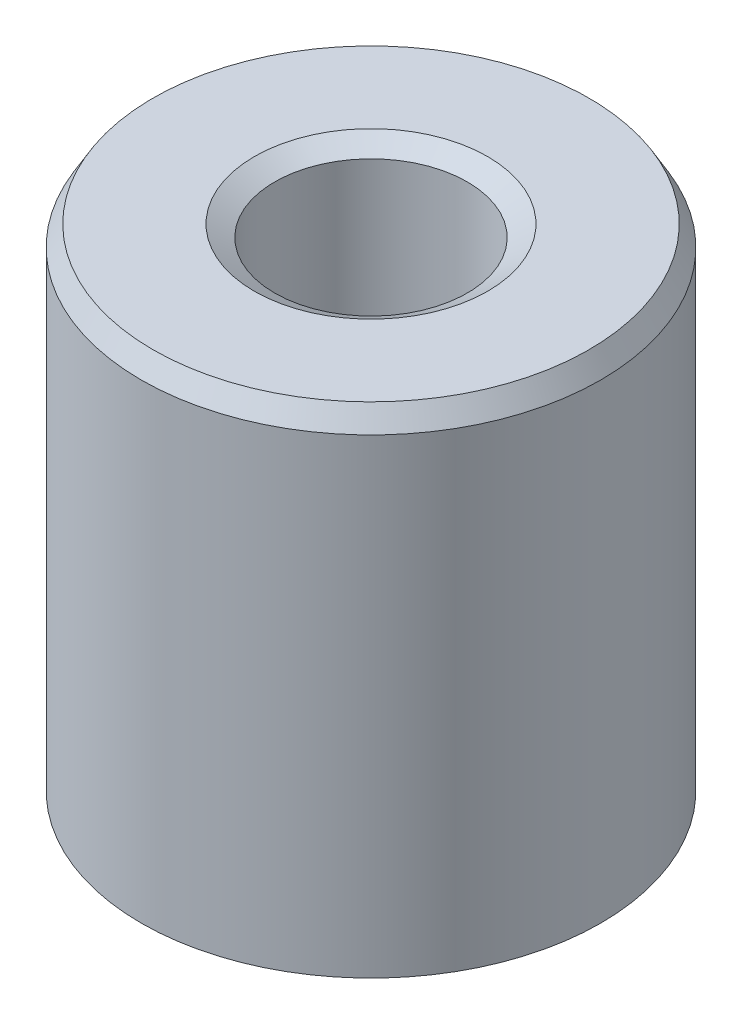
from build123d import *
from OCP.BRepFilletAPI import BRepFilletAPI_MakeChamfer

# Parameters (mm, degrees)
SKETCH1_R           = 37.5
BOSS_EXTRUDE1_DEPTH = 82.025085031
SKETCH2_R           = 15.72536089
CUT_EXTRUDE1_DEPTH  = 98.676069609
CHAMFER1_SIZE       = 3.320158031
CHAMFER1_SIZE2      = 1.916894133


with BuildPart() as part:
    # Sketch1 → Boss-Extrude1 (new body)
    with BuildSketch(Plane(origin=(0, 0, 0), x_dir=(1, 0, 0), z_dir=(0, 1, 0))):
        Circle(SKETCH1_R)
    extrude(amount=BOSS_EXTRUDE1_DEPTH)

    # Sketch2 → Cut-Extrude1 (cut, through all)
    with BuildSketch(Plane(origin=(0, 0, 0), x_dir=(1, 0, 0), z_dir=(0, 1, 0))):
        Circle(SKETCH2_R)
    extrude(amount=CUT_EXTRUDE1_DEPTH, mode=Mode.SUBTRACT)

    # Chamfer1: one chamfer whose edges measure the first distance from different faces: ONE call of the kernel's chamfer builder (chamfer() names one face for all edges)
    chamfer1_edges_1 = [part.edges().sort_by_distance(p)[0] for p in [
        (-15.72536089, 82.025085031, 0),
    ]]
    chamfer1_side_1 = [part.faces().sort_by_distance(p)[0] for p in [
        (-36.439339828, 82.025085031, 0),
    ]]
    chamfer1_edges_2 = [part.edges().sort_by_distance(p)[0] for p in [
        (-15.72536089, 0, 0),
    ]]
    chamfer1_side_2 = [part.faces().sort_by_distance(p)[0] for p in [
        (-15.72536089, 41.012542515, 0),
    ]]
    chamfer1_edges_3 = [part.edges().sort_by_distance(p)[0] for p in [
        (-37.5, 0, 0),
    ]]
    chamfer1_side_3 = [part.faces().sort_by_distance(p)[0] for p in [
        (-36.439339828, 0, 0),
    ]]
    chamfer1_edges_4 = [part.edges().sort_by_distance(p)[0] for p in [
        (-37.5, 82.025085031, 0),
    ]]
    chamfer1_side_4 = [part.faces().sort_by_distance(p)[0] for p in [
        (-37.5, 41.012542515, 0),
    ]]
    chamfer1 = BRepFilletAPI_MakeChamfer(part.part.solid().wrapped)
    for e in chamfer1_edges_1:
        chamfer1.Add(CHAMFER1_SIZE, CHAMFER1_SIZE2, e.wrapped, chamfer1_side_1[0].wrapped)  # the first distance lies on this face
    for e in chamfer1_edges_2:
        chamfer1.Add(CHAMFER1_SIZE, CHAMFER1_SIZE2, e.wrapped, chamfer1_side_2[0].wrapped)  # the first distance lies on this face
    for e in chamfer1_edges_3:
        chamfer1.Add(CHAMFER1_SIZE, CHAMFER1_SIZE2, e.wrapped, chamfer1_side_3[0].wrapped)  # the first distance lies on this face
    for e in chamfer1_edges_4:
        chamfer1.Add(CHAMFER1_SIZE, CHAMFER1_SIZE2, e.wrapped, chamfer1_side_4[0].wrapped)  # the first distance lies on this face
    add(Compound.cast(chamfer1.Shape()), mode=Mode.REPLACE)


solid = part.part
